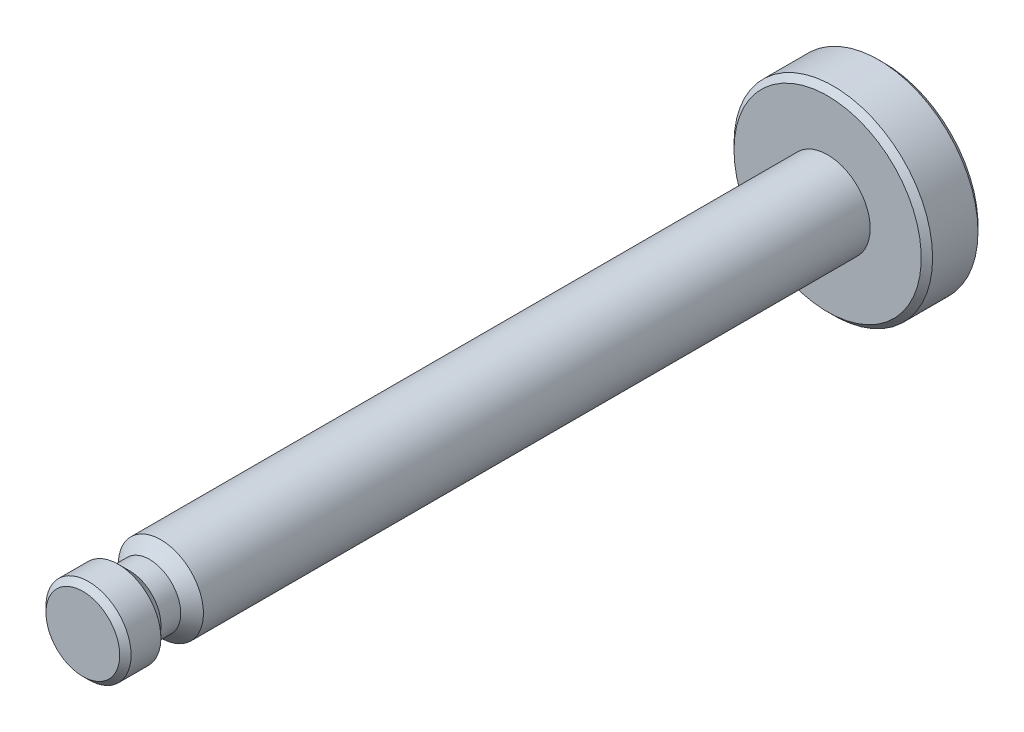
from build123d import *

# Parameters (mm, degrees)
SKETCH2_R   = 1.5
SHAFT_DEPTH = 26.25
SKETCH3_R   = 3.5
HEAD_DEPTH  = 2
DEBURS_SIZE = 0.2


with BuildPart() as part:
    # Sketch2 → Shaft (new body)
    with BuildSketch(Plane.XY):
        Circle(SKETCH2_R)
    extrude(amount=SHAFT_DEPTH)

    # Sketch3 → Head (add)
    with BuildSketch(Plane(origin=(0, 0, 0), x_dir=(-1, 0, 0), z_dir=(0, 0, -1))):
        Circle(SKETCH3_R)
    extrude(amount=HEAD_DEPTH)

    # Sketch4 → e-Clip Notch (revolve, cut)
    with BuildSketch(Plane(origin=(0, 0, 0), x_dir=(0, 0, -1), z_dir=(1, 0, 0))):
        Polygon((-25, 1.5), (-23.5, 1.5), (-23.9, 1.1), (-24.6, 1.1), align=None)
    revolve(axis=Axis((0, 0, 0), (0, 0, 1)), mode=Mode.SUBTRACT)

    # Deburs
    deburs_edges = [part.edges().sort_by_distance(p)[0] for p in [
        (-1.5, 0, 26.25),
        (3.5, 0, 0),
        (3.5, 0, -2),
    ]]
    chamfer(deburs_edges, length=DEBURS_SIZE)


solid = part.part
